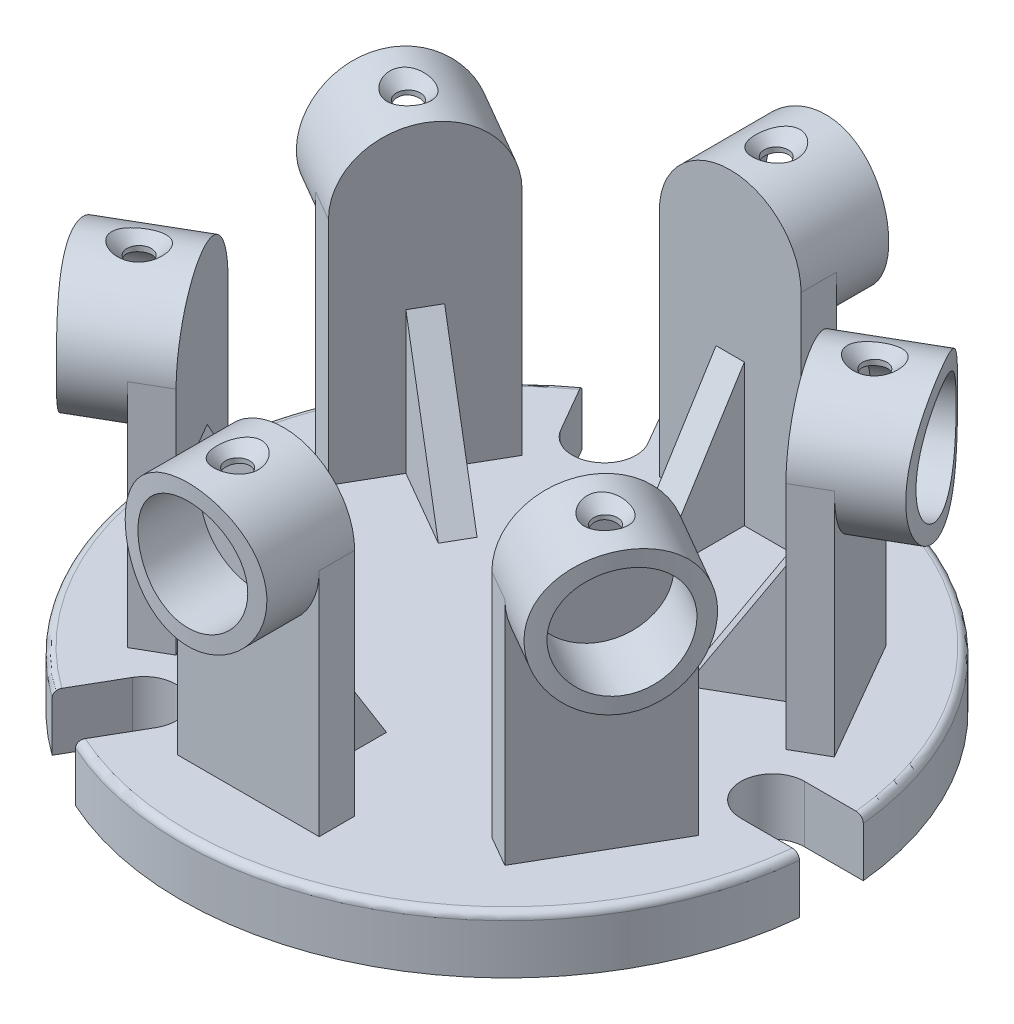
from build123d import *
from build123d.topology import SkipClean

# Parameters (mm, degrees)
SKETCH1_R                       = 46
BOSS_EXTRUDE1_DEPTH             = 8
FILLET1_R                       = 1
CUT_EXTRUDE1_DEPTH              = 8
SKETCH7_W                       = 20
SKETCH7_H                       = 5
BOSS_EXTRUDE2_DEPTH             = 42.5
FILLET2_RADIUS                  = 10
FILLET2_LENGTH                  = 5
BOSS_EXTRUDE3_START             = 10
SKETCH8_R                       = 10
BOSS_EXTRUDE3_DEPTH             = 10
SKETCH9_R                       = 7.75
CUT_EXTRUDE3_DEPTH              = 11
RIB1_START                      = -2
RIB1_DEPTH                      = 4
CIRPATTERN1_COUNT               = 6
FILLET2_OF_CIRPATTERN1_2_RADIUS = 10
FILLET2_OF_CIRPATTERN1_2_LENGTH = 5
FILLET2_OF_CIRPATTERN1_3_RADIUS = 10
FILLET2_OF_CIRPATTERN1_3_LENGTH = 5
FILLET2_OF_CIRPATTERN1_4_RADIUS = 10
FILLET2_OF_CIRPATTERN1_4_LENGTH = 5
FILLET2_OF_CIRPATTERN1_5_RADIUS = 10
FILLET2_OF_CIRPATTERN1_5_LENGTH = 5
FILLET2_OF_CIRPATTERN1_6_RADIUS = 10
FILLET2_OF_CIRPATTERN1_6_LENGTH = 5
SKETCH11_OUTSIDE_W              = 121.795
SKETCH11_OUTSIDE_H              = 123.016
SKETCH11_OUTSIDE_R              = 45
CUT_EXTRUDE4_DEPTH              = 42
CIRPATTERN2_COUNT               = 6


# Read off the part's stored shape, not the designer's step: Rib1, CSK for M3 SFHCS1
with BuildPart() as part:
    # Sketch1 → Boss-Extrude1 (new body)
    with BuildSketch(Plane(origin=(0, 0, 0), x_dir=(1, 0, 0), z_dir=(0, 1, 0))):
        with Locations(Location((0, 0, 0), (0, 0, 270))):
            Circle(SKETCH1_R)
    extrude(amount=BOSS_EXTRUDE1_DEPTH)

    # Fillet1
    fillet1_edges = [part.edges().sort_by_distance(p)[0] for p in [
        (0, 8, -46),
    ]]
    fillet(fillet1_edges, radius=FILLET1_R)

    # Sketch6 → Cut-Extrude1 (cut)
    with BuildSketch(Plane(origin=(0, 8, 0), x_dir=(1, 0, 0), z_dir=(0, 1, 0))):
        with BuildLine():
            Line((37.5, 4.5), (46, 4.5))
            ThreePointArc((46, 4.5), (50.5, 0), (46, -4.5))
            Line((46, -4.5), (37.5, -4.5))
            ThreePointArc((37.5, -4.5), (33, 0), (37.5, 4.5))
        make_face()
        with BuildLine():
            Line((-14.852885683, -34.725952642), (-19.102885683, -42.087168574))
            ThreePointArc((-19.102885683, -42.087168574), (-25.25, -43.734282891), (-26.897114317, -37.587168574))
            Line((-26.897114317, -37.587168574), (-22.647114317, -30.225952642))
            ThreePointArc((-22.647114317, -30.225952642), (-16.5, -28.578838325), (-14.852885683, -34.725952642))
        make_face()
        with BuildLine():
            Line((-22.647114317, 30.225952642), (-26.897114317, 37.587168574))
            ThreePointArc((-26.897114317, 37.587168574), (-25.25, 43.734282891), (-19.102885683, 42.087168574))
            Line((-19.102885683, 42.087168574), (-14.852885683, 34.725952642))
            ThreePointArc((-14.852885683, 34.725952642), (-16.5, 28.578838325), (-22.647114317, 30.225952642))
        make_face()
    extrude(amount=-CUT_EXTRUDE1_DEPTH, mode=Mode.SUBTRACT)

    # Sketch7 → Boss-Extrude2 (add)
    with BuildSketch(Plane(origin=(0, 8, 0), x_dir=(1, 0, 0), z_dir=(0, 1, 0))):
        with Locations((0, 34)):
            Rectangle(SKETCH7_W, SKETCH7_H)
    boss_extrude2 = extrude(amount=BOSS_EXTRUDE2_DEPTH)

    # Fillet2: full round fillet: the end face becomes a half cylinder, R = half its width
    fillet2_face = Plane((0, 50.5, -34), x_dir=(0, 0, -1), z_dir=(0, 1, 0))  # on the end face: x along it, z out of the body
    fillet2_slab = fillet2_face.offset(-FILLET2_RADIUS / 2) * Box(FILLET2_LENGTH, 2 * FILLET2_RADIUS, FILLET2_RADIUS, mode=Mode.PRIVATE)  # the body's end, R deep
    fillet2_round = Plane((0, 40.5, -34), x_dir=(0, 1, 0), z_dir=(0, 0, -1)) * Cylinder(FILLET2_RADIUS, FILLET2_LENGTH, mode=Mode.PRIVATE)  # its axis R under the face
    add(fillet2_slab - fillet2_round, mode=Mode.SUBTRACT)

    # Sketch8 → Boss-Extrude3 (add)
    with BuildSketch(Plane(origin=(0, 0, -36.5), x_dir=(-1, 0, 0), z_dir=(0, 0, -1)).offset(BOSS_EXTRUDE3_START)):
        with Locations((0, 40.5)):
            Circle(SKETCH8_R)
    boss_extrude3 = extrude(amount=-BOSS_EXTRUDE3_DEPTH)

    # Sketch9 → Cut-Extrude3 (cut)
    with BuildSketch(Plane(origin=(0, 0, -46.5), x_dir=(-1, 0, 0), z_dir=(0, 0, -1))):
        with Locations((0, 40.5)):
            Circle(SKETCH9_R)
    cut_extrude3 = extrude(amount=-CUT_EXTRUDE3_DEPTH, mode=Mode.SUBTRACT)

    # Rib1 outline → Rib1 (add)
    with BuildSketch(Plane(origin=(0, 0, 0), x_dir=(0, 0, -1), z_dir=(1, 0, 0)).offset(RIB1_START)):
        Polygon((31.5, 28), (19, 8), (31.5, 8), align=None)
    rib1 = extrude(amount=RIB1_DEPTH)

    # CirPattern1: Boss-Extrude2, Boss-Extrude3, Cut-Extrude3, Rib1 ×6 about axis
    cirpattern1_axis = Axis((0, 0, 0), (0, 1, 0))
    add([boss_extrude2.rotate(cirpattern1_axis, i * 360 / CIRPATTERN1_COUNT) for i in range(1, CIRPATTERN1_COUNT)])
    add([boss_extrude3.rotate(cirpattern1_axis, i * 360 / CIRPATTERN1_COUNT) for i in range(1, CIRPATTERN1_COUNT)])
    add([cut_extrude3.rotate(cirpattern1_axis, i * 360 / CIRPATTERN1_COUNT) for i in range(1, CIRPATTERN1_COUNT)], mode=Mode.SUBTRACT)
    add([rib1.rotate(cirpattern1_axis, i * 360 / CIRPATTERN1_COUNT) for i in range(1, CIRPATTERN1_COUNT)])

    # Fillet2 of CirPattern1 2: full round fillet: the end face becomes a half cylinder, R = half its width
    fillet2_of_cirpattern1_2_face = Plane((-29.444863729, 50.5, -17), x_dir=(-0.866025403784, 0, -0.5), z_dir=(0, 1, 0))  # on the end face: x along it, z out of the body
    fillet2_of_cirpattern1_2_slab = fillet2_of_cirpattern1_2_face.offset(-FILLET2_OF_CIRPATTERN1_2_RADIUS / 2) * Box(FILLET2_OF_CIRPATTERN1_2_LENGTH, 2 * FILLET2_OF_CIRPATTERN1_2_RADIUS, FILLET2_OF_CIRPATTERN1_2_RADIUS, mode=Mode.PRIVATE)  # the body's end, R deep
    fillet2_of_cirpattern1_2_round = Plane((-29.444863729, 40.5, -17), x_dir=(0, 1, 0), z_dir=(-0.866025403784, 0, -0.5)) * Cylinder(FILLET2_OF_CIRPATTERN1_2_RADIUS, FILLET2_OF_CIRPATTERN1_2_LENGTH, mode=Mode.PRIVATE)  # its axis R under the face
    add(fillet2_of_cirpattern1_2_slab - fillet2_of_cirpattern1_2_round, mode=Mode.SUBTRACT)

    # Fillet2 of CirPattern1 3: full round fillet: the end face becomes a half cylinder, R = half its width
    fillet2_of_cirpattern1_3_face = Plane((-29.444863729, 50.5, 17), x_dir=(-0.866025403784, 0, 0.5), z_dir=(0, 1, 0))  # on the end face: x along it, z out of the body
    fillet2_of_cirpattern1_3_slab = fillet2_of_cirpattern1_3_face.offset(-FILLET2_OF_CIRPATTERN1_3_RADIUS / 2) * Box(FILLET2_OF_CIRPATTERN1_3_LENGTH, 2 * FILLET2_OF_CIRPATTERN1_3_RADIUS, FILLET2_OF_CIRPATTERN1_3_RADIUS, mode=Mode.PRIVATE)  # the body's end, R deep
    fillet2_of_cirpattern1_3_round = Plane((-29.444863729, 40.5, 17), x_dir=(0, 1, 0), z_dir=(-0.866025403784, 0, 0.5)) * Cylinder(FILLET2_OF_CIRPATTERN1_3_RADIUS, FILLET2_OF_CIRPATTERN1_3_LENGTH, mode=Mode.PRIVATE)  # its axis R under the face
    add(fillet2_of_cirpattern1_3_slab - fillet2_of_cirpattern1_3_round, mode=Mode.SUBTRACT)

    # Fillet2 of CirPattern1 4: full round fillet: the end face becomes a half cylinder, R = half its width
    fillet2_of_cirpattern1_4_face = Plane((0, 50.5, 34), x_dir=(0, 0, 1), z_dir=(0, 1, 0))  # on the end face: x along it, z out of the body
    fillet2_of_cirpattern1_4_slab = fillet2_of_cirpattern1_4_face.offset(-FILLET2_OF_CIRPATTERN1_4_RADIUS / 2) * Box(FILLET2_OF_CIRPATTERN1_4_LENGTH, 2 * FILLET2_OF_CIRPATTERN1_4_RADIUS, FILLET2_OF_CIRPATTERN1_4_RADIUS, mode=Mode.PRIVATE)  # the body's end, R deep
    fillet2_of_cirpattern1_4_round = Plane((0, 40.5, 34), x_dir=(0, 1, 0), z_dir=(0, 0, 1)) * Cylinder(FILLET2_OF_CIRPATTERN1_4_RADIUS, FILLET2_OF_CIRPATTERN1_4_LENGTH, mode=Mode.PRIVATE)  # its axis R under the face
    add(fillet2_of_cirpattern1_4_slab - fillet2_of_cirpattern1_4_round, mode=Mode.SUBTRACT)

    # Fillet2 of CirPattern1 5: full round fillet: the end face becomes a half cylinder, R = half its width
    fillet2_of_cirpattern1_5_face = Plane((29.444863729, 50.5, 17), x_dir=(0.866025403784, 0, 0.5), z_dir=(0, 1, 0))  # on the end face: x along it, z out of the body
    fillet2_of_cirpattern1_5_slab = fillet2_of_cirpattern1_5_face.offset(-FILLET2_OF_CIRPATTERN1_5_RADIUS / 2) * Box(FILLET2_OF_CIRPATTERN1_5_LENGTH, 2 * FILLET2_OF_CIRPATTERN1_5_RADIUS, FILLET2_OF_CIRPATTERN1_5_RADIUS, mode=Mode.PRIVATE)  # the body's end, R deep
    fillet2_of_cirpattern1_5_round = Plane((29.444863729, 40.5, 17), x_dir=(0, 1, 0), z_dir=(0.866025403784, 0, 0.5)) * Cylinder(FILLET2_OF_CIRPATTERN1_5_RADIUS, FILLET2_OF_CIRPATTERN1_5_LENGTH, mode=Mode.PRIVATE)  # its axis R under the face
    add(fillet2_of_cirpattern1_5_slab - fillet2_of_cirpattern1_5_round, mode=Mode.SUBTRACT)

    # Fillet2 of CirPattern1 6: full round fillet: the end face becomes a half cylinder, R = half its width
    fillet2_of_cirpattern1_6_face = Plane((29.444863729, 50.5, -17), x_dir=(0.866025403784, 0, -0.5), z_dir=(0, 1, 0))  # on the end face: x along it, z out of the body
    fillet2_of_cirpattern1_6_slab = fillet2_of_cirpattern1_6_face.offset(-FILLET2_OF_CIRPATTERN1_6_RADIUS / 2) * Box(FILLET2_OF_CIRPATTERN1_6_LENGTH, 2 * FILLET2_OF_CIRPATTERN1_6_RADIUS, FILLET2_OF_CIRPATTERN1_6_RADIUS, mode=Mode.PRIVATE)  # the body's end, R deep
    fillet2_of_cirpattern1_6_round = Plane((29.444863729, 40.5, -17), x_dir=(0, 1, 0), z_dir=(0.866025403784, 0, -0.5)) * Cylinder(FILLET2_OF_CIRPATTERN1_6_RADIUS, FILLET2_OF_CIRPATTERN1_6_LENGTH, mode=Mode.PRIVATE)  # its axis R under the face
    add(fillet2_of_cirpattern1_6_slab - fillet2_of_cirpattern1_6_round, mode=Mode.SUBTRACT)

    # Sketch11 outside → Cut-Extrude4 (cut)
    with SkipClean():  # the faces are left unmerged after this step: merging them gives an invalid solid
        with BuildSketch(Plane(origin=(0, 53, 0), x_dir=(1, 0, 0), z_dir=(0, 1, 0))):
            with Locations((-0.1105, 0)):
                Rectangle(SKETCH11_OUTSIDE_W, SKETCH11_OUTSIDE_H)
            Circle(SKETCH11_OUTSIDE_R, mode=Mode.SUBTRACT)
        extrude(amount=-CUT_EXTRUDE4_DEPTH, mode=Mode.SUBTRACT)

    # CSK for M3 SFHCS1 outline → CSK for M3 SFHCS1 (revolve, cut)
    with SkipClean():  # the faces are left unmerged after this step: merging them gives an invalid solid
        with BuildSketch(Plane.XY.offset(-38)):
            Polygon((0, 48.061221533), (1.7, 48.061221533), (1.7, 48.84), (3.360200793, 50.500200793), (0, 50.500200793), align=None)
        csk_for_m3_sfhcs1 = revolve(axis=Axis((0, 0, -38), (0, 1, 0)), mode=Mode.SUBTRACT)

    # CirPattern2: CSK for M3 SFHCS1 ×6 about axis
    with SkipClean():  # the faces are left unmerged after this step: merging them gives an invalid solid
        cirpattern2_axis = Axis((0, 0, 0), (0, 1, 0))
        for i in range(1, CIRPATTERN2_COUNT):
            add(csk_for_m3_sfhcs1.rotate(cirpattern2_axis, i * 360 / CIRPATTERN2_COUNT), mode=Mode.SUBTRACT)


solid = part.part
